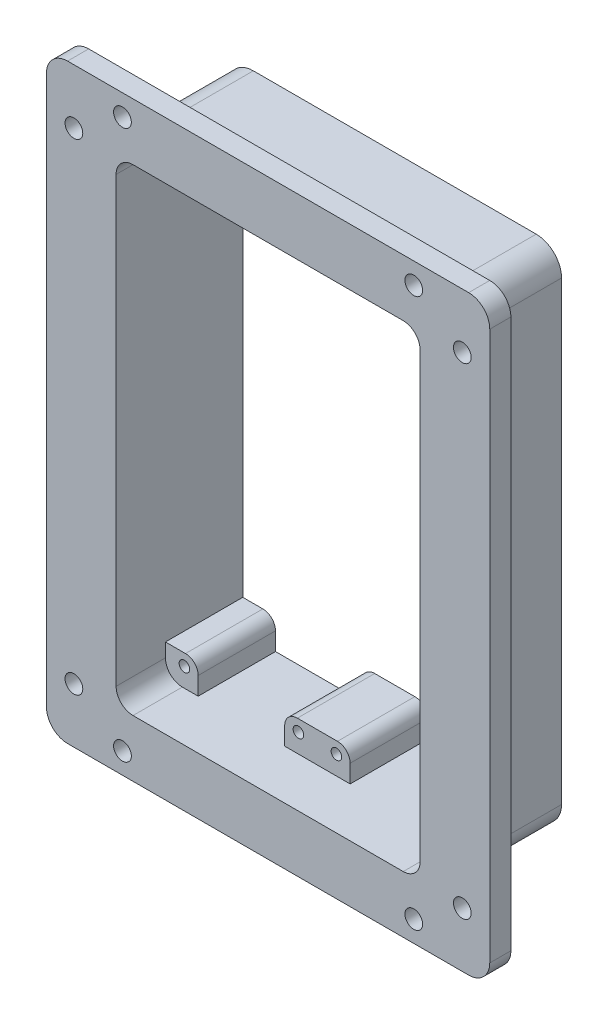
from build123d import *

# Parameters (mm, degrees)
BOSS_EXTRUDE1_DEPTH = 5
BOSS_EXTRUDE2_DEPTH = 25
CUT_EXTRUDE1_REACH  = 94.5
SKETCH4_R           = 2.1
CUT_EXTRUDE2_REACH  = 93.001
BOSS_EXTRUDE4_DEPTH = 18.32
SKETCH9_R           = 1.25
CUT_EXTRUDE3_DEPTH  = 10
CUT_EXTRUDE4_REACH  = 94.5
SKETCH10_R          = 2.1


with BuildPart() as part:
    # Sketch1 → Boss-Extrude1 (new body)
    with BuildSketch(Plane.XY):
        with BuildLine():
            Line((-47.5, 70), (47.5, 70))
            ThreePointArc((47.5, 70), (51.035533906, 68.535533906), (52.5, 65))
            Line((52.5, 65), (52.5, -65))
            ThreePointArc((52.5, -65), (51.035533906, -68.535533906), (47.5, -70))
            Line((47.5, -70), (-47.5, -70))
            ThreePointArc((-47.5, -70), (-51.035533906, -68.535533906), (-52.5, -65))
            Line((-52.5, -65), (-52.5, 65))
            ThreePointArc((-52.5, 65), (-51.035533906, 68.535533906), (-47.5, 70))
        make_face()
        with BuildLine():
            Line((-32, 56.5), (32, 56.5))
            ThreePointArc((32, 56.5), (34.828427125, 55.328427125), (36, 52.5))
            Line((36, 52.5), (36, -52.5))
            ThreePointArc((36, -52.5), (34.828427125, -55.328427125), (32, -56.5))
            Line((32, -56.5), (-32, -56.5))
            ThreePointArc((-32, -56.5), (-34.828427125, -55.328427125), (-36, -52.5))
            Line((-36, -52.5), (-36, 52.5))
            ThreePointArc((-36, 52.5), (-34.828427125, 55.328427125), (-32, 56.5))
        make_face(mode=Mode.SUBTRACT)
    extrude(amount=BOSS_EXTRUDE1_DEPTH)

    # Sketch2 → Boss-Extrude2 (add)
    with BuildSketch(Plane(origin=(0, 0, 0), x_dir=(-1, 0, 0), z_dir=(0, 0, -1))):
        with BuildLine():
            Line((-33.5, 60), (33.5, 60))
            ThreePointArc((33.5, 60), (37.742640687, 58.242640687), (39.5, 54))
            Line((39.5, 54), (39.5, -54))
            ThreePointArc((39.5, -54), (37.742640687, -58.242640687), (33.5, -60))
            Line((33.5, -60), (-33.5, -60))
            ThreePointArc((-33.5, -60), (-37.742640687, -58.242640687), (-39.5, -54))
            Line((-39.5, -54), (-39.5, 54))
            ThreePointArc((-39.5, 54), (-37.742640687, 58.242640687), (-33.5, 60))
        make_face()
    extrude(amount=BOSS_EXTRUDE2_DEPTH)

    # Sketch4 → Cut-Extrude1 (cut, up to next)
    with BuildSketch(Plane.XY.offset(5), mode=Mode.PRIVATE) as cut_extrude1_sk1:
        with Locations((34.5, 65)):
            Circle(SKETCH4_R)
    cut_extrude1_tool1 = extrude(cut_extrude1_sk1.sketch, amount=-CUT_EXTRUDE1_REACH, mode=Mode.PRIVATE) & part.part
    # Sketch4 → Cut-Extrude1 (cut, up to next)
    with BuildSketch(Plane.XY.offset(5), mode=Mode.PRIVATE) as cut_extrude1_sk2:
        with Locations((-34.5, 65)):
            Circle(SKETCH4_R)
    cut_extrude1_tool2 = extrude(cut_extrude1_sk2.sketch, amount=-CUT_EXTRUDE1_REACH, mode=Mode.PRIVATE) & part.part
    # Sketch4 → Cut-Extrude1 (cut, up to next)
    with BuildSketch(Plane.XY.offset(5), mode=Mode.PRIVATE) as cut_extrude1_sk3:
        with Locations((-34.5, -65)):
            Circle(SKETCH4_R)
    cut_extrude1_tool3 = extrude(cut_extrude1_sk3.sketch, amount=-CUT_EXTRUDE1_REACH, mode=Mode.PRIVATE) & part.part
    # Sketch4 → Cut-Extrude1 (cut, up to next)
    with BuildSketch(Plane.XY.offset(5), mode=Mode.PRIVATE) as cut_extrude1_sk4:
        with Locations((34.5, -65)):
            Circle(SKETCH4_R)
    cut_extrude1_tool4 = extrude(cut_extrude1_sk4.sketch, amount=-CUT_EXTRUDE1_REACH, mode=Mode.PRIVATE) & part.part
    add(cut_extrude1_tool1.solids().sort_by_distance((34.5, 65, 5))[0], mode=Mode.SUBTRACT)
    add(cut_extrude1_tool2.solids().sort_by_distance((-34.5, 65, 5))[0], mode=Mode.SUBTRACT)
    add(cut_extrude1_tool3.solids().sort_by_distance((-34.5, -65, 5))[0], mode=Mode.SUBTRACT)
    add(cut_extrude1_tool4.solids().sort_by_distance((34.5, -65, 5))[0], mode=Mode.SUBTRACT)

    # Sketch5 → Cut-Extrude2 (cut, up to next)
    with BuildSketch(Plane.XY, mode=Mode.PRIVATE) as cut_extrude2_sk1:
        with BuildLine():
            Line((-32, 56.5), (32, 56.5))
            ThreePointArc((32, 56.5), (34.828427125, 55.328427125), (36, 52.5))
            Line((36, 52.5), (36, -52.5))
            ThreePointArc((36, -52.5), (34.828427125, -55.328427125), (32, -56.5))
            Line((32, -56.5), (-32, -56.5))
            ThreePointArc((-32, -56.5), (-34.828427125, -55.328427125), (-36, -52.5))
            Line((-36, -52.5), (-36, 52.5))
            ThreePointArc((-36, 52.5), (-34.828427125, 55.328427125), (-32, 56.5))
        make_face()
    cut_extrude2_tool1 = extrude(cut_extrude2_sk1.sketch, amount=-CUT_EXTRUDE2_REACH, mode=Mode.PRIVATE) & part.part
    add(cut_extrude2_tool1.solids().sort_by_distance((0, 0, 0))[0], mode=Mode.SUBTRACT)

    # Sketch8 → Boss-Extrude4 (add)
    with BuildSketch(Plane(origin=(0, 0, -25), x_dir=(-1, 0, 0), z_dir=(0, 0, -1))):
        with BuildLine():
            Line((28.25, 56.5), (28.25, 52.25))
            ThreePointArc((28.25, 52.25), (29.128679656, 50.128679656), (31.25, 49.25))
            Line((31.25, 49.25), (36, 49.25))
            Line((36, 49.25), (36, 52.5))
            ThreePointArc((36, 52.5), (34.828427125, 55.328427125), (32, 56.5))
            Line((32, 56.5), (28.25, 56.5))
        make_face()
        with BuildLine():
            Line((7.75, 52.25), (7.75, 56.5))
            Line((7.75, 56.5), (-7.75, 56.5))
            Line((-7.75, 56.5), (-7.75, 52.25))
            ThreePointArc((-7.75, 52.25), (-6.871320344, 50.128679656), (-4.75, 49.25))
            Line((-4.75, 49.25), (4.75, 49.25))
            ThreePointArc((4.75, 49.25), (6.871320344, 50.128679656), (7.75, 52.25))
        make_face()
        with BuildLine():
            Line((36, -52.5), (36, -49.25))
            Line((36, -49.25), (31.25, -49.25))
            ThreePointArc((31.25, -49.25), (29.128679656, -50.128679656), (28.25, -52.25))
            Line((28.25, -52.25), (28.25, -56.5))
            Line((28.25, -56.5), (32, -56.5))
            ThreePointArc((32, -56.5), (34.828427125, -55.328427125), (36, -52.5))
        make_face()
        with BuildLine():
            Line((-28.25, 52.25), (-28.25, 56.5))
            Line((-28.25, 56.5), (-32, 56.5))
            ThreePointArc((-32, 56.5), (-34.828427125, 55.328427125), (-36, 52.5))
            Line((-36, 52.5), (-36, 49.25))
            Line((-36, 49.25), (-31.25, 49.25))
            ThreePointArc((-31.25, 49.25), (-29.128679656, 50.128679656), (-28.25, 52.25))
        make_face()
        with BuildLine():
            Line((7.75, -56.5), (7.75, -52.25))
            ThreePointArc((7.75, -52.25), (6.871320344, -50.128679656), (4.75, -49.25))
            Line((4.75, -49.25), (-4.75, -49.25))
            ThreePointArc((-4.75, -49.25), (-6.871320344, -50.128679656), (-7.75, -52.25))
            Line((-7.75, -52.25), (-7.75, -56.5))
            Line((-7.75, -56.5), (7.75, -56.5))
        make_face()
        with BuildLine():
            Line((-31.25, -49.25), (-36, -49.25))
            Line((-36, -49.25), (-36, -52.5))
            ThreePointArc((-36, -52.5), (-34.828427125, -55.328427125), (-32, -56.5))
            Line((-32, -56.5), (-28.25, -56.5))
            Line((-28.25, -56.5), (-28.25, -52.25))
            ThreePointArc((-28.25, -52.25), (-29.128679656, -50.128679656), (-31.25, -49.25))
        make_face()
    extrude(amount=-BOSS_EXTRUDE4_DEPTH)

    # Sketch9 → Cut-Extrude3 (cut)
    with BuildSketch(Plane.XY.offset(-6.68)):
        with Locations((-4.5, 52)):
            Circle(SKETCH9_R)
        with Locations((-31.5, 52)):
            Circle(SKETCH9_R)
        with Locations((31.5, 52)):
            Circle(SKETCH9_R)
        with Locations((4.5, 52)):
            Circle(SKETCH9_R)
        with Locations((4.5, -52)):
            Circle(SKETCH9_R)
        with Locations((31.5, -52)):
            Circle(SKETCH9_R)
        with Locations((-31.5, -52)):
            Circle(SKETCH9_R)
        with Locations((-4.5, -52)):
            Circle(SKETCH9_R)
    extrude(amount=-CUT_EXTRUDE3_DEPTH, mode=Mode.SUBTRACT)

    # Sketch10 → Cut-Extrude4 (cut, up to next)
    with BuildSketch(Plane.XY.offset(5), mode=Mode.PRIVATE) as cut_extrude4_sk1:
        with Locations((-46, 57)):
            Circle(SKETCH10_R)
    cut_extrude4_tool1 = extrude(cut_extrude4_sk1.sketch, amount=-CUT_EXTRUDE4_REACH, mode=Mode.PRIVATE) & part.part
    # Sketch10 → Cut-Extrude4 (cut, up to next)
    with BuildSketch(Plane.XY.offset(5), mode=Mode.PRIVATE) as cut_extrude4_sk2:
        with Locations((46, 57)):
            Circle(SKETCH10_R)
    cut_extrude4_tool2 = extrude(cut_extrude4_sk2.sketch, amount=-CUT_EXTRUDE4_REACH, mode=Mode.PRIVATE) & part.part
    # Sketch10 → Cut-Extrude4 (cut, up to next)
    with BuildSketch(Plane.XY.offset(5), mode=Mode.PRIVATE) as cut_extrude4_sk3:
        with Locations((46, -57)):
            Circle(SKETCH10_R)
    cut_extrude4_tool3 = extrude(cut_extrude4_sk3.sketch, amount=-CUT_EXTRUDE4_REACH, mode=Mode.PRIVATE) & part.part
    # Sketch10 → Cut-Extrude4 (cut, up to next)
    with BuildSketch(Plane.XY.offset(5), mode=Mode.PRIVATE) as cut_extrude4_sk4:
        with Locations((-46, -57)):
            Circle(SKETCH10_R)
    cut_extrude4_tool4 = extrude(cut_extrude4_sk4.sketch, amount=-CUT_EXTRUDE4_REACH, mode=Mode.PRIVATE) & part.part
    add(cut_extrude4_tool1.solids().sort_by_distance((-46, 57, 5))[0], mode=Mode.SUBTRACT)
    add(cut_extrude4_tool2.solids().sort_by_distance((46, 57, 5))[0], mode=Mode.SUBTRACT)
    add(cut_extrude4_tool3.solids().sort_by_distance((46, -57, 5))[0], mode=Mode.SUBTRACT)
    add(cut_extrude4_tool4.solids().sort_by_distance((-46, -57, 5))[0], mode=Mode.SUBTRACT)


solid = part.part
